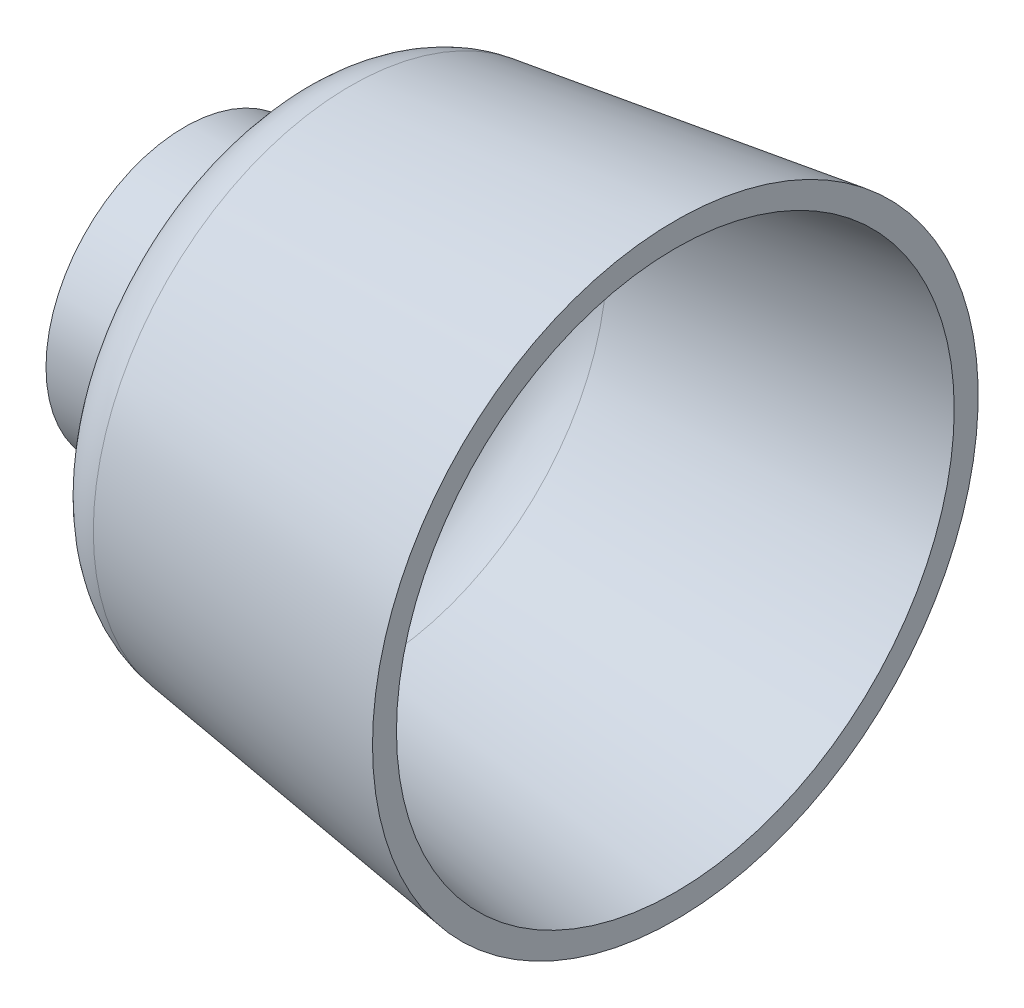
from build123d import *

# Parameters (mm, degrees)
FILLET1_R = 4.7625


with BuildPart() as part:
    # Sketch1 → Revolve1 (revolve)
    with BuildSketch(Plane.XY):
        Polygon((0, 9.27608), (6.35, 9.27608), (7.662583372, 16.720110216), (32.815392318, 20.255106981), (32.815392318, 18.652005709), (9.025682257, 15.30858), (7.682070664, 7.68858), (0, 7.68858), align=None)
    revolve(axis=Axis((0, 0, 0), (1, 0, 0)))

    # Fillet1
    fillet1_edges = [part.edges().sort_by_distance(p)[0] for p in [
        (9.025682257, -15.30858, 0),
        (7.662583372, -16.720110216, 0),
    ]]
    fillet(fillet1_edges, radius=FILLET1_R)


solid = part.part
